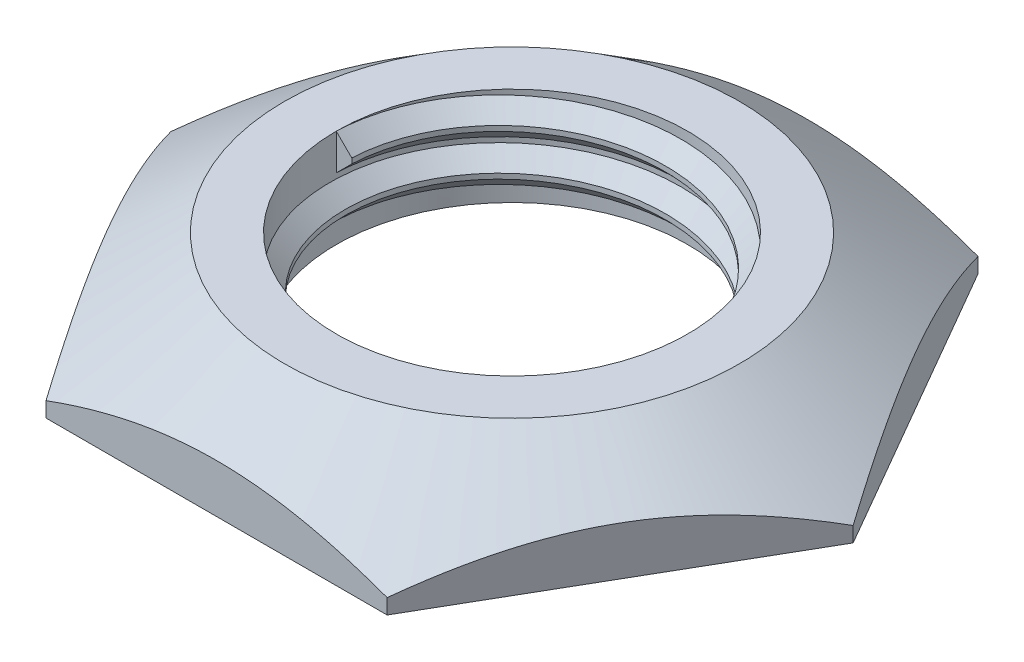
from build123d import *

# Parameters (mm, degrees)
SKETCH_4_R          = 17
CUT_EXTRUDE_2_DEPTH = 10
SWEEP_1_PITCH       = 4
SKETCH_12_W         = 1
SKETCH_12_H         = 0.730769231
SKETCH_13_R         = 34
CUT_EXTRUDE_3_DEPTH = 10


with BuildPart() as part:
    # 草图1 → 旋转1 (revolve)
    with BuildSketch(Plane.XY):
        Polygon((0, 0), (0, -9.5), (-35, -9.5), (-22, 0), align=None)
    revolve(axis=Axis((0, 0, 0), (0, -1, 0)))

    # 草图4 → 切除-拉伸2 (cut)
    with BuildSketch(Plane(origin=(0, 0, 0), x_dir=(1, 0, 0), z_dir=(0, 1, 0))):
        with Locations(Location((0, 0, 0), (0, 0, 180))):
            Circle(SKETCH_4_R)
    extrude(amount=-CUT_EXTRUDE_2_DEPTH, mode=Mode.SUBTRACT)

    # 扫描1: the profile of 草图7 profile screwed along a right-hand helix of 1.5 turns, 12 arcs to a turn; built about Z, then put on its axis
    sweep_1_z = Axis((0, 0, 0), (0, 0, 1))
    sweep_1_corners = [(17.0003, 0, 1.7503), (17.0003, 0, -1.7503), (15.5, 0, -0.25), (15.5, 0, 0.25)]
    with BuildLine(mode=Mode.PRIVATE) as sweep_1_profile:
        Line(sweep_1_corners[0], sweep_1_corners[1])
        Line(sweep_1_corners[1], sweep_1_corners[2])
        Line(sweep_1_corners[2], sweep_1_corners[3])
        Line(sweep_1_corners[3], sweep_1_corners[0])
    sweep_1_cap = Face(sweep_1_profile.wire())
    sweep_1_turn_angles = [0, 15, 30, 45, 60, 75, 90, 105, 120, 135, 150, 165, 180, 195, 210, 225, 240, 255, 270, 285, 300, 315, 330, 345, 360]
    sweep_1_turn_weights = [1, 0.9659258262890683, 1, 0.9659258262890683, 1, 0.9659258262890683, 1, 0.9659258262890683, 1, 0.9659258262890683, 1, 0.9659258262890683, 1, 0.9659258262890683, 1, 0.9659258262890683, 1, 0.9659258262890683, 1, 0.9659258262890683, 1, 0.9659258262890683, 1, 0.9659258262890683, 1]
    sweep_1_turn_rails = [Edge.make_bspline([Vector(p[0], p[1], 0).rotate(sweep_1_z, sweep_1_turn_angles[k]) / sweep_1_turn_weights[k] + Vector(0, 0, p[2] + SWEEP_1_PITCH * sweep_1_turn_angles[k] / 360) for k in range(25)], [0, 0, 0, 1, 1, 2, 2, 3, 3, 4, 4, 5, 5, 6, 6, 7, 7, 8, 8, 9, 9, 10, 10, 11, 11, 12, 12, 12], 2, sweep_1_turn_weights) for p in sweep_1_corners]
    sweep_1_turn_sides = [Face.make_surface_from_curves(sweep_1_turn_rails[p[0]], sweep_1_turn_rails[p[1]]) for p in [(0, 1), (1, 2), (2, 3), (3, 0)]]
    sweep_1_last_angles = [360, 375, 390, 405, 420, 435, 450, 465, 480, 495, 510, 525, 540]
    sweep_1_last_weights = [1, 0.9659258262890683, 1, 0.9659258262890683, 1, 0.9659258262890683, 1, 0.9659258262890683, 1, 0.9659258262890683, 1, 0.965925826289065, 1]
    sweep_1_last_rails = [Edge.make_bspline([Vector(p[0], p[1], 0).rotate(sweep_1_z, sweep_1_last_angles[k]) / sweep_1_last_weights[k] + Vector(0, 0, p[2] + SWEEP_1_PITCH * sweep_1_last_angles[k] / 360) for k in range(13)], [0, 0, 0, 1, 1, 2, 2, 3, 3, 4, 4, 5, 5, 6, 6, 6], 2, sweep_1_last_weights) for p in sweep_1_corners]
    sweep_1_last_sides = [Face.make_surface_from_curves(sweep_1_last_rails[p[0]], sweep_1_last_rails[p[1]]) for p in [(0, 1), (1, 2), (2, 3), (3, 0)]]
    sweep_1 = Plane(origin=(0, -7.75, 0), x_dir=(1, 0, 0), z_dir=(0, 1, 0)) * Solid(Shell([*sweep_1_turn_sides, *sweep_1_last_sides, sweep_1_cap, sweep_1_cap.rotate(sweep_1_z, 540).moved(Location((0, 0, SWEEP_1_PITCH * 540 / 360)))]))
    add(sweep_1)

    # 草图12 → 切除-旋转4 (revolve, cut)
    with BuildSketch(Plane(origin=(0, 0, 0), x_dir=(0, 0, -1), z_dir=(1, 0, 0)), mode=Mode.PRIVATE) as cut_revolve_4_sk:
        with Locations((-34.5, -9.134615384)):
            Rectangle(SKETCH_12_W, SKETCH_12_H)
    revolve(cut_revolve_4_sk.sketch.rotate(Axis((0, 0, 0), (0, 1, 0)), 180), axis=Axis((0, 0, 0), (0, 1, 0)), mode=Mode.SUBTRACT)

    # 草图13 → 切除-拉伸3 (cut)
    with BuildSketch(Plane.XZ.offset(9.5)):
        Circle(SKETCH_13_R)
        Polygon((-33, 0), (-16.5, -28.578838325), (16.5, -28.578838325), (33, 0), (16.5, 28.578838325), (-16.5, 28.578838325), align=None, mode=Mode.SUBTRACT)
    extrude(amount=-CUT_EXTRUDE_3_DEPTH, mode=Mode.SUBTRACT)


solid = part.part
